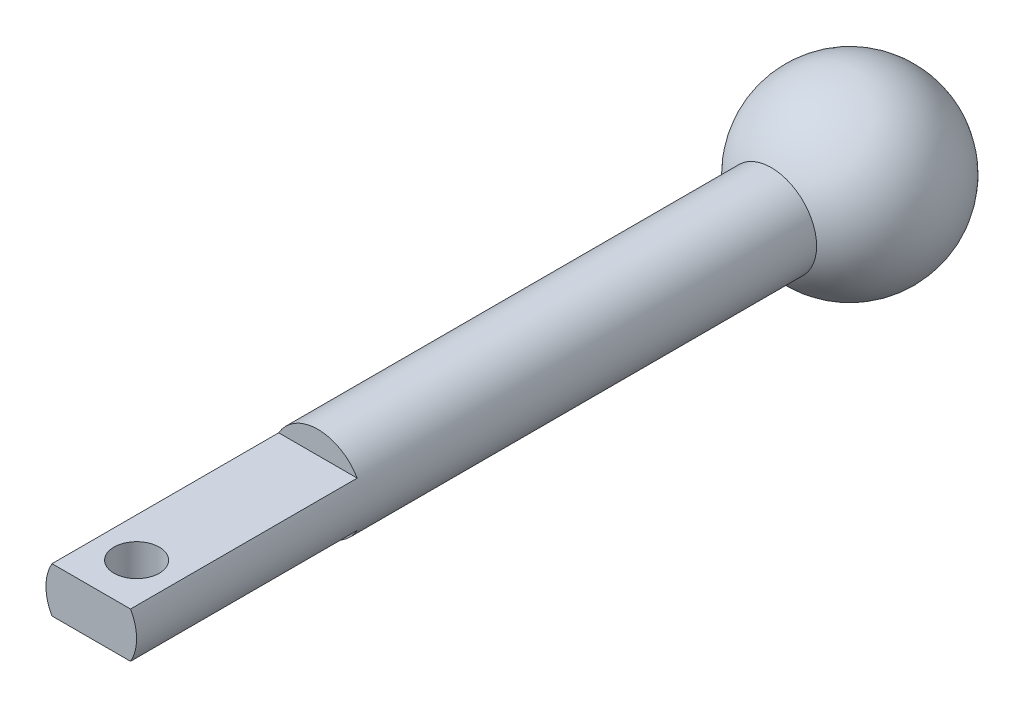
from build123d import *

# Parameters (mm, degrees)
SKETCH2_W               = 10
SKETCH2_H               = 10
CUT_EXTRUDE1_DEPTH      = 1
CUT_EXTRUDE2_DEPTH      = 38.888770234
CUT_EXTRUDE2_DEPTH_BACK = 38.888770234
SKETCH3_R               = 1


with BuildPart() as part:
    # Sketch1 → Revolve1 (revolve)
    with BuildSketch(Plane(origin=(0, 0, 0), x_dir=(1, 0, 0), z_dir=(0, 1, 0))):
        with BuildLine():
            Line((0, 0), (2, 0))
            Line((2, 0), (2, 30))
            ThreePointArc((2, 30), (3.863703305, 34.499377796), (0, 37.464101615))
            Line((0, 37.464101615), (0, 9.5))
            Line((0, 9.5), (0, 0))
        make_face()
    revolve(axis=Axis((0, 0, -9.5), (0, 0, -1)))

    # Sketch2 → Cut-Extrude1 (cut)
    with BuildSketch(Plane(origin=(0, 2, 0), x_dir=(1, 0, 0), z_dir=(0, 1, 0))):
        with Locations((0, 5)):
            Rectangle(SKETCH2_W, SKETCH2_H)
    cut_extrude1 = extrude(amount=-CUT_EXTRUDE1_DEPTH, mode=Mode.SUBTRACT)

    # Sketch3 → Cut-Extrude2 (cut, two sides: drawn at the far end of the back side and taken through both)
    with BuildSketch(Plane(origin=(0, 0, 0), x_dir=(1, 0, 0), z_dir=(0, 1, 0)).offset(-CUT_EXTRUDE2_DEPTH_BACK)):
        with Locations((0, 2)):
            Circle(SKETCH3_R)
    extrude(amount=CUT_EXTRUDE2_DEPTH + CUT_EXTRUDE2_DEPTH_BACK, mode=Mode.SUBTRACT)

    # Mirror1: Cut-Extrude1 across plane
    add(cut_extrude1.mirror(Plane.ZX), mode=Mode.SUBTRACT)


solid = part.part
